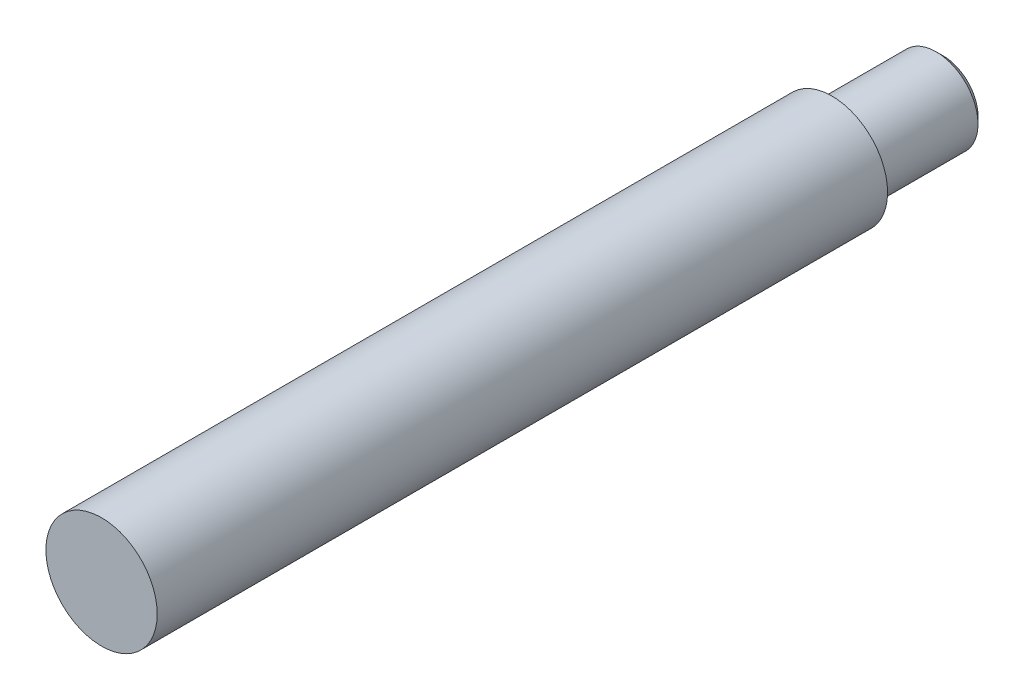
from build123d import *

# Parameters (mm, degrees)
ESQUISSE1_R        = 3
BOSS_EXTRU_1_DEPTH = 8
CHANFREIN1_SIZE    = 0.5
ESQUISSE2_R        = 4
BOSS_EXTRU_2_DEPTH = 52.5


with BuildPart() as part:
    # Esquisse1 → Boss.-Extru.1 (new body)
    with BuildSketch(Plane.XY):
        Circle(ESQUISSE1_R)
    extrude(amount=BOSS_EXTRU_1_DEPTH)

    # Chanfrein1
    chanfrein1_edges = [part.edges().sort_by_distance(p)[0] for p in [
        (-3, 0, 0),
    ]]
    chamfer(chanfrein1_edges, length=CHANFREIN1_SIZE)

    # Esquisse2 → Boss.-Extru.2 (add)
    with BuildSketch(Plane.XY.offset(8)):
        Circle(ESQUISSE2_R)
    extrude(amount=BOSS_EXTRU_2_DEPTH)


solid = part.part
